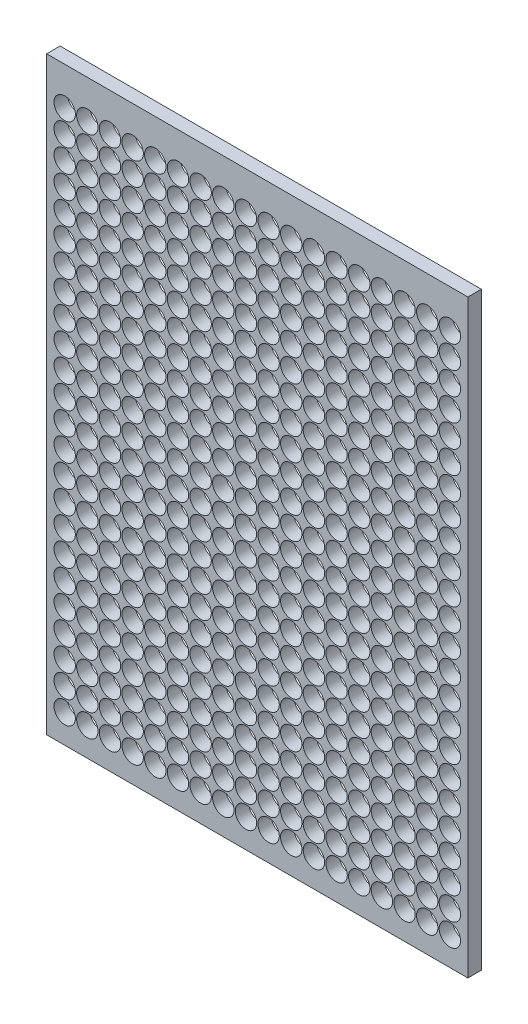
from build123d import *

# Parameters (mm, degrees)
IZIM1_W                     = 50
IZIM1_H                     = 70
Y_KSEKLIK_EKSTR_ZYON1_DEPTH = 1.6
IZIM2_R                     = 1.27
KES_EKSTR_ZYON1_DEPTH       = 1.6


with BuildPart() as part:
    # Çizim1 → Yükseklik-Ekstrüzyon1 (new body)
    with BuildSketch(Plane.XY):
        with Locations((25, -35)):
            Rectangle(IZIM1_W, IZIM1_H)
    extrude(amount=Y_KSEKLIK_EKSTR_ZYON1_DEPTH)

    # Çizim2 → Kes-Ekstrüzyon1 (cut)
    with BuildSketch(Plane.XY.offset(1.6)):
        with Locations((2.14, -4.52)):
            Circle(IZIM2_R)
        with Locations((4.829411765, -4.52)):
            Circle(IZIM2_R)
        with Locations((7.518823529, -4.52)):
            Circle(IZIM2_R)
        with Locations((10.208235294, -4.52)):
            Circle(IZIM2_R)
        with Locations((12.897647059, -4.52)):
            Circle(IZIM2_R)
        with Locations((15.587058824, -4.52)):
            Circle(IZIM2_R)
        with Locations((18.276470588, -4.52)):
            Circle(IZIM2_R)
        with Locations((20.965882353, -4.52)):
            Circle(IZIM2_R)
        with Locations((23.655294118, -4.52)):
            Circle(IZIM2_R)
        with Locations((26.344705882, -4.52)):
            Circle(IZIM2_R)
        with Locations((29.034117647, -4.52)):
            Circle(IZIM2_R)
        with Locations((31.723529412, -4.52)):
            Circle(IZIM2_R)
        with Locations((34.412941176, -4.52)):
            Circle(IZIM2_R)
        with Locations((37.102352941, -4.52)):
            Circle(IZIM2_R)
        with Locations((39.791764706, -4.52)):
            Circle(IZIM2_R)
        with Locations((42.481176471, -4.52)):
            Circle(IZIM2_R)
        with Locations((45.170588235, -4.52)):
            Circle(IZIM2_R)
        with Locations((47.86, -4.52)):
            Circle(IZIM2_R)
        with Locations((47.86, -7.22)):
            Circle(IZIM2_R)
        with Locations((45.170588235, -7.22)):
            Circle(IZIM2_R)
        with Locations((42.481176471, -7.22)):
            Circle(IZIM2_R)
        with Locations((39.791764706, -7.22)):
            Circle(IZIM2_R)
        with Locations((37.102352941, -7.22)):
            Circle(IZIM2_R)
        with Locations((34.412941176, -7.22)):
            Circle(IZIM2_R)
        with Locations((31.723529412, -7.22)):
            Circle(IZIM2_R)
        with Locations((26.344705882, -7.22)):
            Circle(IZIM2_R)
        with Locations((29.034117647, -7.22)):
            Circle(IZIM2_R)
        with Locations((23.655294118, -7.22)):
            Circle(IZIM2_R)
        with Locations((20.965882353, -7.22)):
            Circle(IZIM2_R)
        with Locations((18.276470588, -7.22)):
            Circle(IZIM2_R)
        with Locations((15.587058824, -7.22)):
            Circle(IZIM2_R)
        with Locations((12.897647059, -7.22)):
            Circle(IZIM2_R)
        with Locations((10.208235294, -7.22)):
            Circle(IZIM2_R)
        with Locations((7.518823529, -7.22)):
            Circle(IZIM2_R)
        with Locations((4.829411765, -7.22)):
            Circle(IZIM2_R)
        with Locations((2.14, -7.22)):
            Circle(IZIM2_R)
        with Locations((47.86, -9.92)):
            Circle(IZIM2_R)
        with Locations((45.170588235, -9.92)):
            Circle(IZIM2_R)
        with Locations((42.481176471, -9.92)):
            Circle(IZIM2_R)
        with Locations((39.791764706, -9.92)):
            Circle(IZIM2_R)
        with Locations((37.102352941, -9.92)):
            Circle(IZIM2_R)
        with Locations((34.412941176, -9.92)):
            Circle(IZIM2_R)
        with Locations((31.723529412, -9.92)):
            Circle(IZIM2_R)
        with Locations((26.344705882, -9.92)):
            Circle(IZIM2_R)
        with Locations((29.034117647, -9.92)):
            Circle(IZIM2_R)
        with Locations((23.655294118, -9.92)):
            Circle(IZIM2_R)
        with Locations((20.965882353, -9.92)):
            Circle(IZIM2_R)
        with Locations((18.276470588, -9.92)):
            Circle(IZIM2_R)
        with Locations((15.587058824, -9.92)):
            Circle(IZIM2_R)
        with Locations((12.897647059, -9.92)):
            Circle(IZIM2_R)
        with Locations((10.208235294, -9.92)):
            Circle(IZIM2_R)
        with Locations((7.518823529, -9.92)):
            Circle(IZIM2_R)
        with Locations((4.829411765, -9.92)):
            Circle(IZIM2_R)
        with Locations((2.14, -9.92)):
            Circle(IZIM2_R)
        with Locations((47.86, -12.62)):
            Circle(IZIM2_R)
        with Locations((45.170588235, -12.62)):
            Circle(IZIM2_R)
        with Locations((42.481176471, -12.62)):
            Circle(IZIM2_R)
        with Locations((39.791764706, -12.62)):
            Circle(IZIM2_R)
        with Locations((37.102352941, -12.62)):
            Circle(IZIM2_R)
        with Locations((34.412941176, -12.62)):
            Circle(IZIM2_R)
        with Locations((31.723529412, -12.62)):
            Circle(IZIM2_R)
        with Locations((26.344705882, -12.62)):
            Circle(IZIM2_R)
        with Locations((29.034117647, -12.62)):
            Circle(IZIM2_R)
        with Locations((23.655294118, -12.62)):
            Circle(IZIM2_R)
        with Locations((20.965882353, -12.62)):
            Circle(IZIM2_R)
        with Locations((18.276470588, -12.62)):
            Circle(IZIM2_R)
        with Locations((15.587058824, -12.62)):
            Circle(IZIM2_R)
        with Locations((12.897647059, -12.62)):
            Circle(IZIM2_R)
        with Locations((10.208235294, -12.62)):
            Circle(IZIM2_R)
        with Locations((7.518823529, -12.62)):
            Circle(IZIM2_R)
        with Locations((4.829411765, -12.62)):
            Circle(IZIM2_R)
        with Locations((2.14, -12.62)):
            Circle(IZIM2_R)
        with Locations((47.86, -15.32)):
            Circle(IZIM2_R)
        with Locations((45.170588235, -15.32)):
            Circle(IZIM2_R)
        with Locations((42.481176471, -15.32)):
            Circle(IZIM2_R)
        with Locations((39.791764706, -15.32)):
            Circle(IZIM2_R)
        with Locations((37.102352941, -15.32)):
            Circle(IZIM2_R)
        with Locations((34.412941176, -15.32)):
            Circle(IZIM2_R)
        with Locations((31.723529412, -15.32)):
            Circle(IZIM2_R)
        with Locations((26.344705882, -15.32)):
            Circle(IZIM2_R)
        with Locations((29.034117647, -15.32)):
            Circle(IZIM2_R)
        with Locations((23.655294118, -15.32)):
            Circle(IZIM2_R)
        with Locations((20.965882353, -15.32)):
            Circle(IZIM2_R)
        with Locations((18.276470588, -15.32)):
            Circle(IZIM2_R)
        with Locations((15.587058824, -15.32)):
            Circle(IZIM2_R)
        with Locations((12.897647059, -15.32)):
            Circle(IZIM2_R)
        with Locations((10.208235294, -15.32)):
            Circle(IZIM2_R)
        with Locations((7.518823529, -15.32)):
            Circle(IZIM2_R)
        with Locations((4.829411765, -15.32)):
            Circle(IZIM2_R)
        with Locations((2.14, -15.32)):
            Circle(IZIM2_R)
        with Locations((47.86, -18.02)):
            Circle(IZIM2_R)
        with Locations((45.170588235, -18.02)):
            Circle(IZIM2_R)
        with Locations((42.481176471, -18.02)):
            Circle(IZIM2_R)
        with Locations((39.791764706, -18.02)):
            Circle(IZIM2_R)
        with Locations((37.102352941, -18.02)):
            Circle(IZIM2_R)
        with Locations((34.412941176, -18.02)):
            Circle(IZIM2_R)
        with Locations((31.723529412, -18.02)):
            Circle(IZIM2_R)
        with Locations((26.344705882, -18.02)):
            Circle(IZIM2_R)
        with Locations((29.034117647, -18.02)):
            Circle(IZIM2_R)
        with Locations((23.655294118, -18.02)):
            Circle(IZIM2_R)
        with Locations((20.965882353, -18.02)):
            Circle(IZIM2_R)
        with Locations((18.276470588, -18.02)):
            Circle(IZIM2_R)
        with Locations((15.587058824, -18.02)):
            Circle(IZIM2_R)
        with Locations((12.897647059, -18.02)):
            Circle(IZIM2_R)
        with Locations((10.208235294, -18.02)):
            Circle(IZIM2_R)
        with Locations((7.518823529, -18.02)):
            Circle(IZIM2_R)
        with Locations((4.829411765, -18.02)):
            Circle(IZIM2_R)
        with Locations((2.14, -18.02)):
            Circle(IZIM2_R)
        with Locations((47.86, -20.72)):
            Circle(IZIM2_R)
        with Locations((45.170588235, -20.72)):
            Circle(IZIM2_R)
        with Locations((42.481176471, -20.72)):
            Circle(IZIM2_R)
        with Locations((39.791764706, -20.72)):
            Circle(IZIM2_R)
        with Locations((37.102352941, -20.72)):
            Circle(IZIM2_R)
        with Locations((34.412941176, -20.72)):
            Circle(IZIM2_R)
        with Locations((31.723529412, -20.72)):
            Circle(IZIM2_R)
        with Locations((26.344705882, -20.72)):
            Circle(IZIM2_R)
        with Locations((29.034117647, -20.72)):
            Circle(IZIM2_R)
        with Locations((23.655294118, -20.72)):
            Circle(IZIM2_R)
        with Locations((20.965882353, -20.72)):
            Circle(IZIM2_R)
        with Locations((18.276470588, -20.72)):
            Circle(IZIM2_R)
        with Locations((15.587058824, -20.72)):
            Circle(IZIM2_R)
        with Locations((12.897647059, -20.72)):
            Circle(IZIM2_R)
        with Locations((10.208235294, -20.72)):
            Circle(IZIM2_R)
        with Locations((7.518823529, -20.72)):
            Circle(IZIM2_R)
        with Locations((4.829411765, -20.72)):
            Circle(IZIM2_R)
        with Locations((2.14, -20.72)):
            Circle(IZIM2_R)
        with Locations((47.86, -23.42)):
            Circle(IZIM2_R)
        with Locations((45.170588235, -23.42)):
            Circle(IZIM2_R)
        with Locations((42.481176471, -23.42)):
            Circle(IZIM2_R)
        with Locations((39.791764706, -23.42)):
            Circle(IZIM2_R)
        with Locations((37.102352941, -23.42)):
            Circle(IZIM2_R)
        with Locations((34.412941176, -23.42)):
            Circle(IZIM2_R)
        with Locations((31.723529412, -23.42)):
            Circle(IZIM2_R)
        with Locations((26.344705882, -23.42)):
            Circle(IZIM2_R)
        with Locations((29.034117647, -23.42)):
            Circle(IZIM2_R)
        with Locations((23.655294118, -23.42)):
            Circle(IZIM2_R)
        with Locations((20.965882353, -23.42)):
            Circle(IZIM2_R)
        with Locations((18.276470588, -23.42)):
            Circle(IZIM2_R)
        with Locations((15.587058824, -23.42)):
            Circle(IZIM2_R)
        with Locations((12.897647059, -23.42)):
            Circle(IZIM2_R)
        with Locations((10.208235294, -23.42)):
            Circle(IZIM2_R)
        with Locations((7.518823529, -23.42)):
            Circle(IZIM2_R)
        with Locations((4.829411765, -23.42)):
            Circle(IZIM2_R)
        with Locations((2.14, -23.42)):
            Circle(IZIM2_R)
        with Locations((47.86, -26.12)):
            Circle(IZIM2_R)
        with Locations((45.170588235, -26.12)):
            Circle(IZIM2_R)
        with Locations((42.481176471, -26.12)):
            Circle(IZIM2_R)
        with Locations((39.791764706, -26.12)):
            Circle(IZIM2_R)
        with Locations((37.102352941, -26.12)):
            Circle(IZIM2_R)
        with Locations((34.412941176, -26.12)):
            Circle(IZIM2_R)
        with Locations((31.723529412, -26.12)):
            Circle(IZIM2_R)
        with Locations((26.344705882, -26.12)):
            Circle(IZIM2_R)
        with Locations((29.034117647, -26.12)):
            Circle(IZIM2_R)
        with Locations((23.655294118, -26.12)):
            Circle(IZIM2_R)
        with Locations((20.965882353, -26.12)):
            Circle(IZIM2_R)
        with Locations((18.276470588, -26.12)):
            Circle(IZIM2_R)
        with Locations((15.587058824, -26.12)):
            Circle(IZIM2_R)
        with Locations((12.897647059, -26.12)):
            Circle(IZIM2_R)
        with Locations((10.208235294, -26.12)):
            Circle(IZIM2_R)
        with Locations((7.518823529, -26.12)):
            Circle(IZIM2_R)
        with Locations((4.829411765, -26.12)):
            Circle(IZIM2_R)
        with Locations((2.14, -26.12)):
            Circle(IZIM2_R)
        with Locations((47.86, -28.82)):
            Circle(IZIM2_R)
        with Locations((45.170588235, -28.82)):
            Circle(IZIM2_R)
        with Locations((42.481176471, -28.82)):
            Circle(IZIM2_R)
        with Locations((39.791764706, -28.82)):
            Circle(IZIM2_R)
        with Locations((37.102352941, -28.82)):
            Circle(IZIM2_R)
        with Locations((34.412941176, -28.82)):
            Circle(IZIM2_R)
        with Locations((31.723529412, -28.82)):
            Circle(IZIM2_R)
        with Locations((26.344705882, -28.82)):
            Circle(IZIM2_R)
        with Locations((29.034117647, -28.82)):
            Circle(IZIM2_R)
        with Locations((23.655294118, -28.82)):
            Circle(IZIM2_R)
        with Locations((20.965882353, -28.82)):
            Circle(IZIM2_R)
        with Locations((18.276470588, -28.82)):
            Circle(IZIM2_R)
        with Locations((15.587058824, -28.82)):
            Circle(IZIM2_R)
        with Locations((12.897647059, -28.82)):
            Circle(IZIM2_R)
        with Locations((10.208235294, -28.82)):
            Circle(IZIM2_R)
        with Locations((7.518823529, -28.82)):
            Circle(IZIM2_R)
        with Locations((4.829411765, -28.82)):
            Circle(IZIM2_R)
        with Locations((2.14, -28.82)):
            Circle(IZIM2_R)
        with Locations((47.86, -31.52)):
            Circle(IZIM2_R)
        with Locations((45.170588235, -31.52)):
            Circle(IZIM2_R)
        with Locations((42.481176471, -31.52)):
            Circle(IZIM2_R)
        with Locations((39.791764706, -31.52)):
            Circle(IZIM2_R)
        with Locations((37.102352941, -31.52)):
            Circle(IZIM2_R)
        with Locations((34.412941176, -31.52)):
            Circle(IZIM2_R)
        with Locations((31.723529412, -31.52)):
            Circle(IZIM2_R)
        with Locations((26.344705882, -31.52)):
            Circle(IZIM2_R)
        with Locations((29.034117647, -31.52)):
            Circle(IZIM2_R)
        with Locations((23.655294118, -31.52)):
            Circle(IZIM2_R)
        with Locations((20.965882353, -31.52)):
            Circle(IZIM2_R)
        with Locations((18.276470588, -31.52)):
            Circle(IZIM2_R)
        with Locations((15.587058824, -31.52)):
            Circle(IZIM2_R)
        with Locations((12.897647059, -31.52)):
            Circle(IZIM2_R)
        with Locations((10.208235294, -31.52)):
            Circle(IZIM2_R)
        with Locations((7.518823529, -31.52)):
            Circle(IZIM2_R)
        with Locations((4.829411765, -31.52)):
            Circle(IZIM2_R)
        with Locations((2.14, -31.52)):
            Circle(IZIM2_R)
        with Locations((47.86, -34.22)):
            Circle(IZIM2_R)
        with Locations((45.170588235, -34.22)):
            Circle(IZIM2_R)
        with Locations((42.481176471, -34.22)):
            Circle(IZIM2_R)
        with Locations((39.791764706, -34.22)):
            Circle(IZIM2_R)
        with Locations((37.102352941, -34.22)):
            Circle(IZIM2_R)
        with Locations((34.412941176, -34.22)):
            Circle(IZIM2_R)
        with Locations((31.723529412, -34.22)):
            Circle(IZIM2_R)
        with Locations((26.344705882, -34.22)):
            Circle(IZIM2_R)
        with Locations((29.034117647, -34.22)):
            Circle(IZIM2_R)
        with Locations((23.655294118, -34.22)):
            Circle(IZIM2_R)
        with Locations((20.965882353, -34.22)):
            Circle(IZIM2_R)
        with Locations((18.276470588, -34.22)):
            Circle(IZIM2_R)
        with Locations((15.587058824, -34.22)):
            Circle(IZIM2_R)
        with Locations((12.897647059, -34.22)):
            Circle(IZIM2_R)
        with Locations((10.208235294, -34.22)):
            Circle(IZIM2_R)
        with Locations((7.518823529, -34.22)):
            Circle(IZIM2_R)
        with Locations((4.829411765, -34.22)):
            Circle(IZIM2_R)
        with Locations((2.14, -34.22)):
            Circle(IZIM2_R)
        with Locations((47.86, -36.92)):
            Circle(IZIM2_R)
        with Locations((45.170588235, -36.92)):
            Circle(IZIM2_R)
        with Locations((42.481176471, -36.92)):
            Circle(IZIM2_R)
        with Locations((39.791764706, -36.92)):
            Circle(IZIM2_R)
        with Locations((37.102352941, -36.92)):
            Circle(IZIM2_R)
        with Locations((34.412941176, -36.92)):
            Circle(IZIM2_R)
        with Locations((31.723529412, -36.92)):
            Circle(IZIM2_R)
        with Locations((26.344705882, -36.92)):
            Circle(IZIM2_R)
        with Locations((29.034117647, -36.92)):
            Circle(IZIM2_R)
        with Locations((23.655294118, -36.92)):
            Circle(IZIM2_R)
        with Locations((20.965882353, -36.92)):
            Circle(IZIM2_R)
        with Locations((18.276470588, -36.92)):
            Circle(IZIM2_R)
        with Locations((15.587058824, -36.92)):
            Circle(IZIM2_R)
        with Locations((12.897647059, -36.92)):
            Circle(IZIM2_R)
        with Locations((10.208235294, -36.92)):
            Circle(IZIM2_R)
        with Locations((7.518823529, -36.92)):
            Circle(IZIM2_R)
        with Locations((4.829411765, -36.92)):
            Circle(IZIM2_R)
        with Locations((2.14, -36.92)):
            Circle(IZIM2_R)
        with Locations((47.86, -39.62)):
            Circle(IZIM2_R)
        with Locations((45.170588235, -39.62)):
            Circle(IZIM2_R)
        with Locations((42.481176471, -39.62)):
            Circle(IZIM2_R)
        with Locations((39.791764706, -39.62)):
            Circle(IZIM2_R)
        with Locations((37.102352941, -39.62)):
            Circle(IZIM2_R)
        with Locations((34.412941176, -39.62)):
            Circle(IZIM2_R)
        with Locations((31.723529412, -39.62)):
            Circle(IZIM2_R)
        with Locations((26.344705882, -39.62)):
            Circle(IZIM2_R)
        with Locations((29.034117647, -39.62)):
            Circle(IZIM2_R)
        with Locations((23.655294118, -39.62)):
            Circle(IZIM2_R)
        with Locations((20.965882353, -39.62)):
            Circle(IZIM2_R)
        with Locations((18.276470588, -39.62)):
            Circle(IZIM2_R)
        with Locations((15.587058824, -39.62)):
            Circle(IZIM2_R)
        with Locations((12.897647059, -39.62)):
            Circle(IZIM2_R)
        with Locations((10.208235294, -39.62)):
            Circle(IZIM2_R)
        with Locations((7.518823529, -39.62)):
            Circle(IZIM2_R)
        with Locations((4.829411765, -39.62)):
            Circle(IZIM2_R)
        with Locations((2.14, -39.62)):
            Circle(IZIM2_R)
        with Locations((47.86, -42.32)):
            Circle(IZIM2_R)
        with Locations((45.170588235, -42.32)):
            Circle(IZIM2_R)
        with Locations((42.481176471, -42.32)):
            Circle(IZIM2_R)
        with Locations((39.791764706, -42.32)):
            Circle(IZIM2_R)
        with Locations((37.102352941, -42.32)):
            Circle(IZIM2_R)
        with Locations((34.412941176, -42.32)):
            Circle(IZIM2_R)
        with Locations((31.723529412, -42.32)):
            Circle(IZIM2_R)
        with Locations((26.344705882, -42.32)):
            Circle(IZIM2_R)
        with Locations((29.034117647, -42.32)):
            Circle(IZIM2_R)
        with Locations((23.655294118, -42.32)):
            Circle(IZIM2_R)
        with Locations((20.965882353, -42.32)):
            Circle(IZIM2_R)
        with Locations((18.276470588, -42.32)):
            Circle(IZIM2_R)
        with Locations((15.587058824, -42.32)):
            Circle(IZIM2_R)
        with Locations((12.897647059, -42.32)):
            Circle(IZIM2_R)
        with Locations((10.208235294, -42.32)):
            Circle(IZIM2_R)
        with Locations((7.518823529, -42.32)):
            Circle(IZIM2_R)
        with Locations((4.829411765, -42.32)):
            Circle(IZIM2_R)
        with Locations((2.14, -42.32)):
            Circle(IZIM2_R)
        with Locations((47.86, -45.02)):
            Circle(IZIM2_R)
        with Locations((45.170588235, -45.02)):
            Circle(IZIM2_R)
        with Locations((42.481176471, -45.02)):
            Circle(IZIM2_R)
        with Locations((39.791764706, -45.02)):
            Circle(IZIM2_R)
        with Locations((37.102352941, -45.02)):
            Circle(IZIM2_R)
        with Locations((34.412941176, -45.02)):
            Circle(IZIM2_R)
        with Locations((31.723529412, -45.02)):
            Circle(IZIM2_R)
        with Locations((26.344705882, -45.02)):
            Circle(IZIM2_R)
        with Locations((29.034117647, -45.02)):
            Circle(IZIM2_R)
        with Locations((23.655294118, -45.02)):
            Circle(IZIM2_R)
        with Locations((20.965882353, -45.02)):
            Circle(IZIM2_R)
        with Locations((18.276470588, -45.02)):
            Circle(IZIM2_R)
        with Locations((15.587058824, -45.02)):
            Circle(IZIM2_R)
        with Locations((12.897647059, -45.02)):
            Circle(IZIM2_R)
        with Locations((10.208235294, -45.02)):
            Circle(IZIM2_R)
        with Locations((7.518823529, -45.02)):
            Circle(IZIM2_R)
        with Locations((4.829411765, -45.02)):
            Circle(IZIM2_R)
        with Locations((2.14, -45.02)):
            Circle(IZIM2_R)
        with Locations((47.86, -47.72)):
            Circle(IZIM2_R)
        with Locations((45.170588235, -47.72)):
            Circle(IZIM2_R)
        with Locations((42.481176471, -47.72)):
            Circle(IZIM2_R)
        with Locations((39.791764706, -47.72)):
            Circle(IZIM2_R)
        with Locations((37.102352941, -47.72)):
            Circle(IZIM2_R)
        with Locations((34.412941176, -47.72)):
            Circle(IZIM2_R)
        with Locations((31.723529412, -47.72)):
            Circle(IZIM2_R)
        with Locations((26.344705882, -47.72)):
            Circle(IZIM2_R)
        with Locations((29.034117647, -47.72)):
            Circle(IZIM2_R)
        with Locations((23.655294118, -47.72)):
            Circle(IZIM2_R)
        with Locations((20.965882353, -47.72)):
            Circle(IZIM2_R)
        with Locations((18.276470588, -47.72)):
            Circle(IZIM2_R)
        with Locations((15.587058824, -47.72)):
            Circle(IZIM2_R)
        with Locations((12.897647059, -47.72)):
            Circle(IZIM2_R)
        with Locations((10.208235294, -47.72)):
            Circle(IZIM2_R)
        with Locations((7.518823529, -47.72)):
            Circle(IZIM2_R)
        with Locations((4.829411765, -47.72)):
            Circle(IZIM2_R)
        with Locations((2.14, -47.72)):
            Circle(IZIM2_R)
        with Locations((47.86, -50.42)):
            Circle(IZIM2_R)
        with Locations((45.170588235, -50.42)):
            Circle(IZIM2_R)
        with Locations((42.481176471, -50.42)):
            Circle(IZIM2_R)
        with Locations((39.791764706, -50.42)):
            Circle(IZIM2_R)
        with Locations((37.102352941, -50.42)):
            Circle(IZIM2_R)
        with Locations((34.412941176, -50.42)):
            Circle(IZIM2_R)
        with Locations((31.723529412, -50.42)):
            Circle(IZIM2_R)
        with Locations((26.344705882, -50.42)):
            Circle(IZIM2_R)
        with Locations((29.034117647, -50.42)):
            Circle(IZIM2_R)
        with Locations((23.655294118, -50.42)):
            Circle(IZIM2_R)
        with Locations((20.965882353, -50.42)):
            Circle(IZIM2_R)
        with Locations((18.276470588, -50.42)):
            Circle(IZIM2_R)
        with Locations((15.587058824, -50.42)):
            Circle(IZIM2_R)
        with Locations((12.897647059, -50.42)):
            Circle(IZIM2_R)
        with Locations((10.208235294, -50.42)):
            Circle(IZIM2_R)
        with Locations((7.518823529, -50.42)):
            Circle(IZIM2_R)
        with Locations((4.829411765, -50.42)):
            Circle(IZIM2_R)
        with Locations((2.14, -50.42)):
            Circle(IZIM2_R)
        with Locations((47.86, -53.12)):
            Circle(IZIM2_R)
        with Locations((45.170588235, -53.12)):
            Circle(IZIM2_R)
        with Locations((42.481176471, -53.12)):
            Circle(IZIM2_R)
        with Locations((39.791764706, -53.12)):
            Circle(IZIM2_R)
        with Locations((37.102352941, -53.12)):
            Circle(IZIM2_R)
        with Locations((34.412941176, -53.12)):
            Circle(IZIM2_R)
        with Locations((31.723529412, -53.12)):
            Circle(IZIM2_R)
        with Locations((26.344705882, -53.12)):
            Circle(IZIM2_R)
        with Locations((29.034117647, -53.12)):
            Circle(IZIM2_R)
        with Locations((23.655294118, -53.12)):
            Circle(IZIM2_R)
        with Locations((20.965882353, -53.12)):
            Circle(IZIM2_R)
        with Locations((18.276470588, -53.12)):
            Circle(IZIM2_R)
        with Locations((15.587058824, -53.12)):
            Circle(IZIM2_R)
        with Locations((12.897647059, -53.12)):
            Circle(IZIM2_R)
        with Locations((10.208235294, -53.12)):
            Circle(IZIM2_R)
        with Locations((7.518823529, -53.12)):
            Circle(IZIM2_R)
        with Locations((4.829411765, -53.12)):
            Circle(IZIM2_R)
        with Locations((2.14, -53.12)):
            Circle(IZIM2_R)
        with Locations((47.86, -55.82)):
            Circle(IZIM2_R)
        with Locations((45.170588235, -55.82)):
            Circle(IZIM2_R)
        with Locations((42.481176471, -55.82)):
            Circle(IZIM2_R)
        with Locations((39.791764706, -55.82)):
            Circle(IZIM2_R)
        with Locations((37.102352941, -55.82)):
            Circle(IZIM2_R)
        with Locations((34.412941176, -55.82)):
            Circle(IZIM2_R)
        with Locations((31.723529412, -55.82)):
            Circle(IZIM2_R)
        with Locations((26.344705882, -55.82)):
            Circle(IZIM2_R)
        with Locations((29.034117647, -55.82)):
            Circle(IZIM2_R)
        with Locations((23.655294118, -55.82)):
            Circle(IZIM2_R)
        with Locations((20.965882353, -55.82)):
            Circle(IZIM2_R)
        with Locations((18.276470588, -55.82)):
            Circle(IZIM2_R)
        with Locations((15.587058824, -55.82)):
            Circle(IZIM2_R)
        with Locations((12.897647059, -55.82)):
            Circle(IZIM2_R)
        with Locations((10.208235294, -55.82)):
            Circle(IZIM2_R)
        with Locations((7.518823529, -55.82)):
            Circle(IZIM2_R)
        with Locations((4.829411765, -55.82)):
            Circle(IZIM2_R)
        with Locations((2.14, -55.82)):
            Circle(IZIM2_R)
        with Locations((47.86, -58.52)):
            Circle(IZIM2_R)
        with Locations((45.170588235, -58.52)):
            Circle(IZIM2_R)
        with Locations((42.481176471, -58.52)):
            Circle(IZIM2_R)
        with Locations((39.791764706, -58.52)):
            Circle(IZIM2_R)
        with Locations((37.102352941, -58.52)):
            Circle(IZIM2_R)
        with Locations((34.412941176, -58.52)):
            Circle(IZIM2_R)
        with Locations((31.723529412, -58.52)):
            Circle(IZIM2_R)
        with Locations((26.344705882, -58.52)):
            Circle(IZIM2_R)
        with Locations((29.034117647, -58.52)):
            Circle(IZIM2_R)
        with Locations((23.655294118, -58.52)):
            Circle(IZIM2_R)
        with Locations((20.965882353, -58.52)):
            Circle(IZIM2_R)
        with Locations((18.276470588, -58.52)):
            Circle(IZIM2_R)
        with Locations((15.587058824, -58.52)):
            Circle(IZIM2_R)
        with Locations((12.897647059, -58.52)):
            Circle(IZIM2_R)
        with Locations((10.208235294, -58.52)):
            Circle(IZIM2_R)
        with Locations((7.518823529, -58.52)):
            Circle(IZIM2_R)
        with Locations((4.829411765, -58.52)):
            Circle(IZIM2_R)
        with Locations((2.14, -58.52)):
            Circle(IZIM2_R)
        with Locations((47.86, -61.22)):
            Circle(IZIM2_R)
        with Locations((45.170588235, -61.22)):
            Circle(IZIM2_R)
        with Locations((42.481176471, -61.22)):
            Circle(IZIM2_R)
        with Locations((39.791764706, -61.22)):
            Circle(IZIM2_R)
        with Locations((37.102352941, -61.22)):
            Circle(IZIM2_R)
        with Locations((34.412941176, -61.22)):
            Circle(IZIM2_R)
        with Locations((31.723529412, -61.22)):
            Circle(IZIM2_R)
        with Locations((26.344705882, -61.22)):
            Circle(IZIM2_R)
        with Locations((29.034117647, -61.22)):
            Circle(IZIM2_R)
        with Locations((23.655294118, -61.22)):
            Circle(IZIM2_R)
        with Locations((20.965882353, -61.22)):
            Circle(IZIM2_R)
        with Locations((18.276470588, -61.22)):
            Circle(IZIM2_R)
        with Locations((15.587058824, -61.22)):
            Circle(IZIM2_R)
        with Locations((12.897647059, -61.22)):
            Circle(IZIM2_R)
        with Locations((10.208235294, -61.22)):
            Circle(IZIM2_R)
        with Locations((7.518823529, -61.22)):
            Circle(IZIM2_R)
        with Locations((4.829411765, -61.22)):
            Circle(IZIM2_R)
        with Locations((2.14, -61.22)):
            Circle(IZIM2_R)
        with Locations((47.86, -63.92)):
            Circle(IZIM2_R)
        with Locations((45.170588235, -63.92)):
            Circle(IZIM2_R)
        with Locations((42.481176471, -63.92)):
            Circle(IZIM2_R)
        with Locations((39.791764706, -63.92)):
            Circle(IZIM2_R)
        with Locations((37.102352941, -63.92)):
            Circle(IZIM2_R)
        with Locations((34.412941176, -63.92)):
            Circle(IZIM2_R)
        with Locations((31.723529412, -63.92)):
            Circle(IZIM2_R)
        with Locations((26.344705882, -63.92)):
            Circle(IZIM2_R)
        with Locations((29.034117647, -63.92)):
            Circle(IZIM2_R)
        with Locations((23.655294118, -63.92)):
            Circle(IZIM2_R)
        with Locations((20.965882353, -63.92)):
            Circle(IZIM2_R)
        with Locations((18.276470588, -63.92)):
            Circle(IZIM2_R)
        with Locations((15.587058824, -63.92)):
            Circle(IZIM2_R)
        with Locations((12.897647059, -63.92)):
            Circle(IZIM2_R)
        with Locations((10.208235294, -63.92)):
            Circle(IZIM2_R)
        with Locations((7.518823529, -63.92)):
            Circle(IZIM2_R)
        with Locations((4.829411765, -63.92)):
            Circle(IZIM2_R)
        with Locations((2.14, -63.92)):
            Circle(IZIM2_R)
        with Locations((47.86, -66.62)):
            Circle(IZIM2_R)
        with Locations((45.170588235, -66.62)):
            Circle(IZIM2_R)
        with Locations((42.481176471, -66.62)):
            Circle(IZIM2_R)
        with Locations((39.791764706, -66.62)):
            Circle(IZIM2_R)
        with Locations((37.102352941, -66.62)):
            Circle(IZIM2_R)
        with Locations((34.412941176, -66.62)):
            Circle(IZIM2_R)
        with Locations((31.723529412, -66.62)):
            Circle(IZIM2_R)
        with Locations((26.344705882, -66.62)):
            Circle(IZIM2_R)
        with Locations((29.034117647, -66.62)):
            Circle(IZIM2_R)
        with Locations((23.655294118, -66.62)):
            Circle(IZIM2_R)
        with Locations((20.965882353, -66.62)):
            Circle(IZIM2_R)
        with Locations((18.276470588, -66.62)):
            Circle(IZIM2_R)
        with Locations((15.587058824, -66.62)):
            Circle(IZIM2_R)
        with Locations((12.897647059, -66.62)):
            Circle(IZIM2_R)
        with Locations((10.208235294, -66.62)):
            Circle(IZIM2_R)
        with Locations((7.518823529, -66.62)):
            Circle(IZIM2_R)
        with Locations((4.829411765, -66.62)):
            Circle(IZIM2_R)
        with Locations((2.14, -66.62)):
            Circle(IZIM2_R)
    extrude(amount=-KES_EKSTR_ZYON1_DEPTH, mode=Mode.SUBTRACT)


solid = part.part
